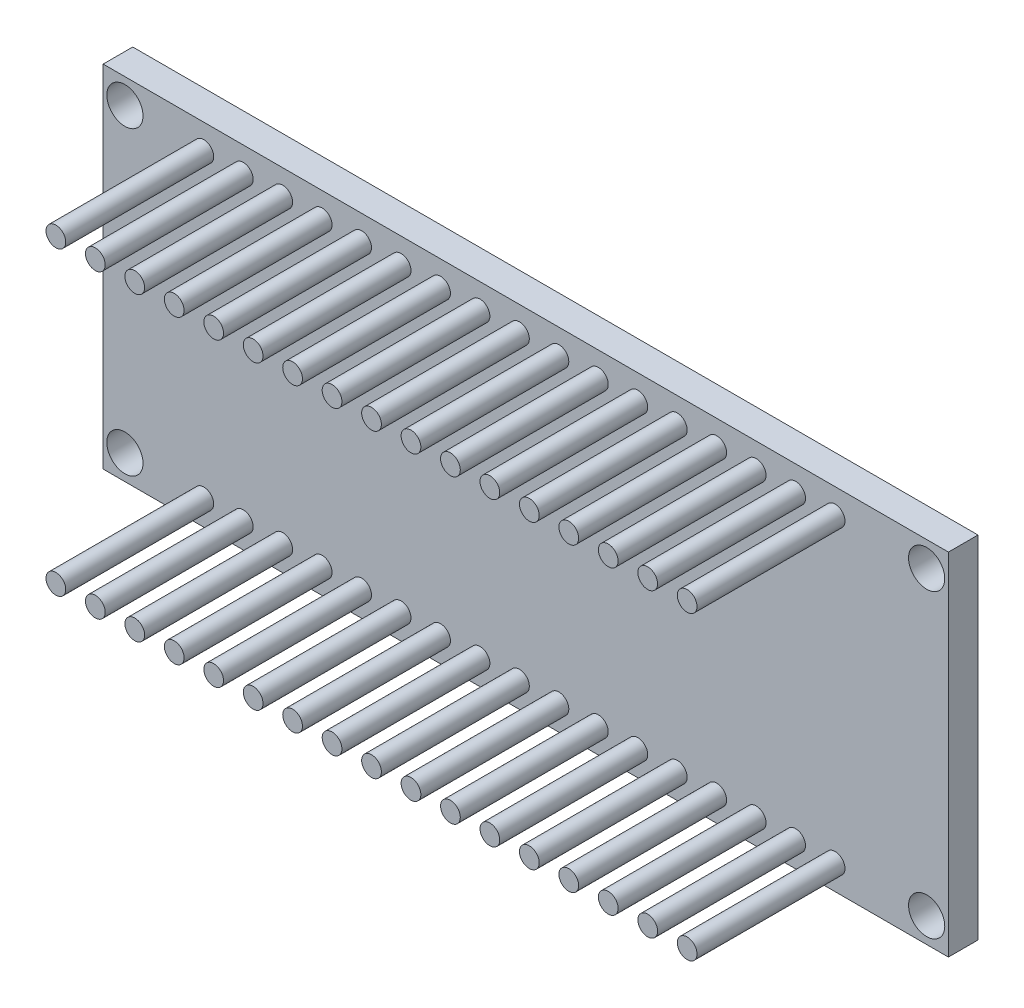
from build123d import *

# Parameters (mm, degrees)
SKETCH1_W           = 42.844819815
SKETCH1_H           = 17.78
SKETCH1_R           = 0.917394869
BOSS_EXTRUDE1_DEPTH = 1.5
SKETCH2_R           = 0.5
BOSS_EXTRUDE2_DEPTH = 7.5
SKETCH3_W           = 5
SKETCH3_H           = 7
BOSS_EXTRUDE3_DEPTH = 2
FILLET1_R           = 0.75


with BuildPart() as part:
    # Sketch1 → Boss-Extrude1 (new body)
    with BuildSketch(Plane.XY):
        with Locations((-197.662982249, 61.653534283)):
            Rectangle(SKETCH1_W, SKETCH1_H)
        with Locations((-217.982982248, 69.278534283)):
            Circle(SKETCH1_R, mode=Mode.SUBTRACT)
        with Locations((-217.982982248, 54.028534283)):
            Circle(SKETCH1_R, mode=Mode.SUBTRACT)
        with Locations((-177.342982248, 54.028534283)):
            Circle(SKETCH1_R, mode=Mode.SUBTRACT)
        with Locations((-177.342982248, 69.278534283)):
            Circle(SKETCH1_R, mode=Mode.SUBTRACT)
    extrude(amount=BOSS_EXTRUDE1_DEPTH)

    # Sketch2 → Boss-Extrude2 (add)
    with BuildSketch(Plane.XY.offset(1.5)):
        with Locations((-213.982982248, 69.278534283)):
            Circle(SKETCH2_R)
        with Locations((-213.982982248, 54.028534283)):
            Circle(SKETCH2_R)
        with Locations((-211.982982248, 69.278534283)):
            Circle(SKETCH2_R)
        with Locations((-211.982982248, 54.028534283)):
            Circle(SKETCH2_R)
        with Locations((-209.982982248, 69.278534283)):
            Circle(SKETCH2_R)
        with Locations((-209.982982248, 54.028534283)):
            Circle(SKETCH2_R)
        with Locations((-207.982982248, 69.278534283)):
            Circle(SKETCH2_R)
        with Locations((-207.982982248, 54.028534283)):
            Circle(SKETCH2_R)
        with Locations((-205.982982248, 69.278534283)):
            Circle(SKETCH2_R)
        with Locations((-205.982982248, 54.028534283)):
            Circle(SKETCH2_R)
        with Locations((-203.982982248, 69.278534283)):
            Circle(SKETCH2_R)
        with Locations((-203.982982248, 54.028534283)):
            Circle(SKETCH2_R)
        with Locations((-201.982982248, 69.278534283)):
            Circle(SKETCH2_R)
        with Locations((-201.982982248, 54.028534283)):
            Circle(SKETCH2_R)
        with Locations((-199.982982248, 69.278534283)):
            Circle(SKETCH2_R)
        with Locations((-199.982982248, 54.028534283)):
            Circle(SKETCH2_R)
        with Locations((-197.982982248, 69.278534283)):
            Circle(SKETCH2_R)
        with Locations((-197.982982248, 54.028534283)):
            Circle(SKETCH2_R)
        with Locations((-195.982982248, 69.278534283)):
            Circle(SKETCH2_R)
        with Locations((-195.982982248, 54.028534283)):
            Circle(SKETCH2_R)
        with Locations((-193.982982248, 69.278534283)):
            Circle(SKETCH2_R)
        with Locations((-193.982982248, 54.028534283)):
            Circle(SKETCH2_R)
        with Locations((-191.982982248, 69.278534283)):
            Circle(SKETCH2_R)
        with Locations((-191.982982248, 54.028534283)):
            Circle(SKETCH2_R)
        with Locations((-189.982982248, 69.278534283)):
            Circle(SKETCH2_R)
        with Locations((-189.982982248, 54.028534283)):
            Circle(SKETCH2_R)
        with Locations((-187.982982248, 69.278534283)):
            Circle(SKETCH2_R)
        with Locations((-187.982982248, 54.028534283)):
            Circle(SKETCH2_R)
        with Locations((-185.982982248, 69.278534283)):
            Circle(SKETCH2_R)
        with Locations((-185.982982248, 54.028534283)):
            Circle(SKETCH2_R)
        with Locations((-183.982982248, 69.278534283)):
            Circle(SKETCH2_R)
        with Locations((-183.982982248, 54.028534283)):
            Circle(SKETCH2_R)
        with Locations((-181.982982248, 69.278534283)):
            Circle(SKETCH2_R)
        with Locations((-181.982982248, 54.028534283)):
            Circle(SKETCH2_R)
    extrude(amount=BOSS_EXTRUDE2_DEPTH)

    # Sketch3 → Boss-Extrude3 (add)
    with BuildSketch(Plane(origin=(0, 0, 0), x_dir=(-1, 0, 0), z_dir=(0, 0, -1))):
        with Locations((217.835392156, 61.653534283)):
            Rectangle(SKETCH3_W, SKETCH3_H)
    extrude(amount=BOSS_EXTRUDE3_DEPTH)

    # Fillet1
    fillet1_edges = [part.edges().sort_by_distance(p)[0] for p in [
        (-219.710392156, 65.153534283, 0),
        (-217.835392156, 65.153534283, -2),
        (-219.710392156, 58.153534283, 0),
        (-217.835392156, 58.153534283, -2),
    ]]
    fillet(fillet1_edges, radius=FILLET1_R)


solid = part.part
